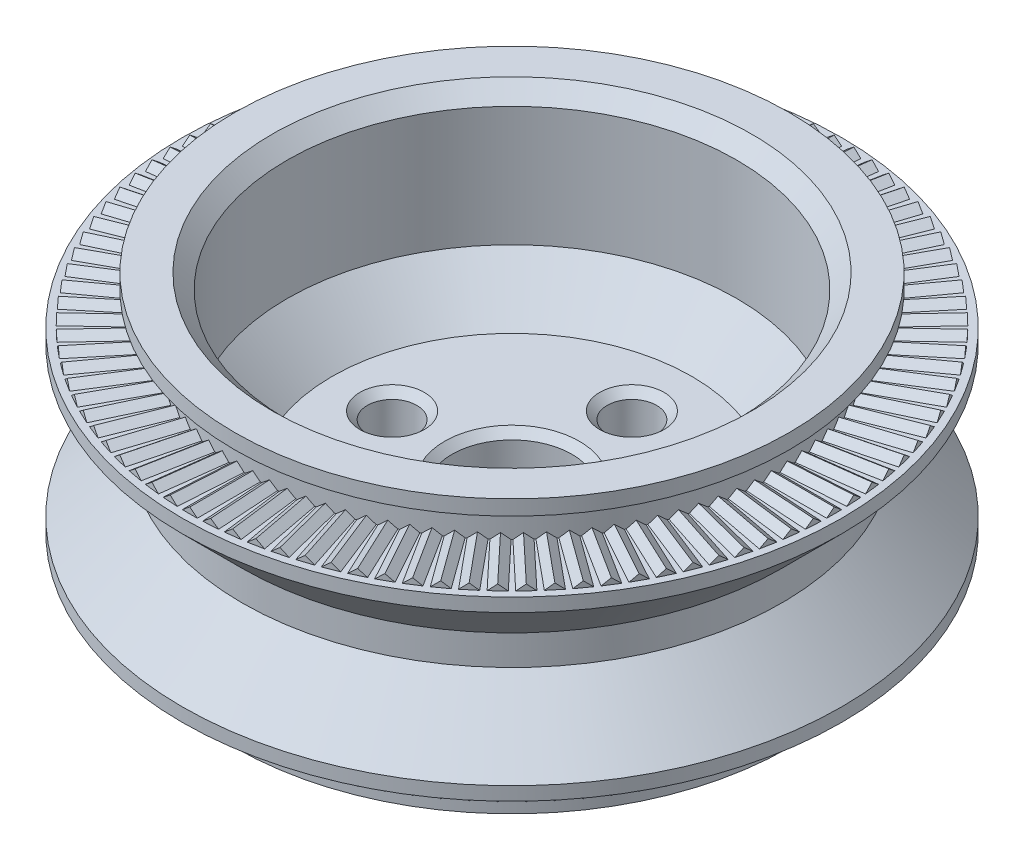
from build123d import *

# Parameters (mm, degrees)
SKETCH_1_R               = 22
EXTRUDE_1_DEPTH          = 9.1
SKETCH_2_W               = 4.7
SKETCH_2_H               = 2.2
SKETCH_2_W_2             = 3.5
SKETCH_2_H_2             = 1
SKETCH_3_R               = 15
CUT_EXTRUDE_1_DEPTH      = 3
SKETCH_4_R               = 4
CUT_EXTRUDE_2_DEPTH      = 20
SKETCH_5_R               = 1.65
CUT_EXTRUDE_3_DEPTH      = 20
PATTERN_CIRCULAR_1_COUNT = 4
CUT_EXTRUDE_START        = -6.2
SKETCH_3_2_R             = 15
CUT_EXTRUDE_4_DEPTH      = 12
SKETCH_6_W               = 4
SKETCH_6_H               = 10
CHAMFER_1_SIZE           = 4
CHAMFER_2_SIZE           = 3
CHAMFER_3_SIZE           = 1
CHAMFER_4_SIZE           = 0.5
EXTRUDE_START            = 16
EXTRUDE_4_DEPTH          = 5.5
PATTERN_CIRCULAR_2_COUNT = 100
MIRROR_START             = 16
MIRROR_2_COPY_1_DEPTH    = 5.5
MIRROR_2_COPY_2_DEPTH    = 5.5
MIRROR_2_COPY_3_DEPTH    = 5.5
MIRROR_2_COPY_4_DEPTH    = 5.5
MIRROR_2_COPY_5_DEPTH    = 5.5
MIRROR_2_COPY_6_DEPTH    = 5.5
MIRROR_2_COPY_7_DEPTH    = 5.5
MIRROR_2_COPY_8_DEPTH    = 5.5
MIRROR_2_COPY_9_DEPTH    = 5.5
MIRROR_2_COPY_10_DEPTH   = 5.5
MIRROR_2_COPY_11_DEPTH   = 5.5
MIRROR_2_COPY_12_DEPTH   = 5.5
MIRROR_2_COPY_13_DEPTH   = 5.5
MIRROR_2_COPY_14_DEPTH   = 5.5
MIRROR_2_COPY_15_DEPTH   = 5.5
MIRROR_2_COPY_16_DEPTH   = 5.5
MIRROR_2_COPY_17_DEPTH   = 5.5
MIRROR_2_COPY_18_DEPTH   = 5.5
MIRROR_2_COPY_19_DEPTH   = 5.5
MIRROR_2_COPY_20_DEPTH   = 5.5
MIRROR_2_COPY_21_DEPTH   = 5.5
MIRROR_2_COPY_22_DEPTH   = 5.5
MIRROR_2_COPY_23_DEPTH   = 5.5
MIRROR_2_COPY_24_DEPTH   = 5.5
MIRROR_2_COPY_25_DEPTH   = 5.5
MIRROR_2_COPY_26_DEPTH   = 5.5
MIRROR_2_COPY_27_DEPTH   = 5.5
MIRROR_2_COPY_28_DEPTH   = 5.5
MIRROR_2_COPY_29_DEPTH   = 5.5
MIRROR_2_COPY_30_DEPTH   = 5.5
MIRROR_2_COPY_31_DEPTH   = 5.5
MIRROR_2_COPY_32_DEPTH   = 5.5
MIRROR_2_COPY_33_DEPTH   = 5.5
MIRROR_2_COPY_34_DEPTH   = 5.5
MIRROR_2_COPY_35_DEPTH   = 5.5
MIRROR_2_COPY_36_DEPTH   = 5.5
MIRROR_2_COPY_37_DEPTH   = 5.5
MIRROR_2_COPY_38_DEPTH   = 5.5
MIRROR_2_COPY_39_DEPTH   = 5.5
MIRROR_2_COPY_40_DEPTH   = 5.5
MIRROR_2_COPY_41_DEPTH   = 5.5
MIRROR_2_COPY_42_DEPTH   = 5.5
MIRROR_2_COPY_43_DEPTH   = 5.5
MIRROR_2_COPY_44_DEPTH   = 5.5
MIRROR_2_COPY_45_DEPTH   = 5.5
MIRROR_2_COPY_46_DEPTH   = 5.5
MIRROR_2_COPY_47_DEPTH   = 5.5
MIRROR_2_COPY_48_DEPTH   = 5.5
MIRROR_2_COPY_49_DEPTH   = 5.5
MIRROR_2_COPY_50_DEPTH   = 5.5
MIRROR_2_COPY_51_DEPTH   = 5.5
MIRROR_2_COPY_52_DEPTH   = 5.5
MIRROR_2_COPY_53_DEPTH   = 5.5
MIRROR_2_COPY_54_DEPTH   = 5.5
MIRROR_2_COPY_55_DEPTH   = 5.5
MIRROR_2_COPY_56_DEPTH   = 5.5
MIRROR_2_COPY_57_DEPTH   = 5.5
MIRROR_2_COPY_58_DEPTH   = 5.5
MIRROR_2_COPY_59_DEPTH   = 5.5
MIRROR_2_COPY_60_DEPTH   = 5.5
MIRROR_2_COPY_61_DEPTH   = 5.5
MIRROR_2_COPY_62_DEPTH   = 5.5
MIRROR_2_COPY_63_DEPTH   = 5.5
MIRROR_2_COPY_64_DEPTH   = 5.5
MIRROR_2_COPY_65_DEPTH   = 5.5
MIRROR_2_COPY_66_DEPTH   = 5.5
MIRROR_2_COPY_67_DEPTH   = 5.5
MIRROR_2_COPY_68_DEPTH   = 5.5
MIRROR_2_COPY_69_DEPTH   = 5.5
MIRROR_2_COPY_70_DEPTH   = 5.5
MIRROR_2_COPY_71_DEPTH   = 5.5
MIRROR_2_COPY_72_DEPTH   = 5.5
MIRROR_2_COPY_73_DEPTH   = 5.5
MIRROR_2_COPY_74_DEPTH   = 5.5
MIRROR_2_COPY_75_DEPTH   = 5.5
MIRROR_2_COPY_76_DEPTH   = 5.5
MIRROR_2_COPY_77_DEPTH   = 5.5
MIRROR_2_COPY_78_DEPTH   = 5.5
MIRROR_2_COPY_79_DEPTH   = 5.5
MIRROR_2_COPY_80_DEPTH   = 5.5
MIRROR_2_COPY_81_DEPTH   = 5.5
MIRROR_2_COPY_82_DEPTH   = 5.5
MIRROR_2_COPY_83_DEPTH   = 5.5
MIRROR_2_COPY_84_DEPTH   = 5.5
MIRROR_2_COPY_85_DEPTH   = 5.5
MIRROR_2_COPY_86_DEPTH   = 5.5
MIRROR_2_COPY_87_DEPTH   = 5.5
MIRROR_2_COPY_88_DEPTH   = 5.5
MIRROR_2_COPY_89_DEPTH   = 5.5
MIRROR_2_COPY_90_DEPTH   = 5.5
MIRROR_2_COPY_91_DEPTH   = 5.5
MIRROR_2_COPY_92_DEPTH   = 5.5
MIRROR_2_COPY_93_DEPTH   = 5.5
MIRROR_2_COPY_94_DEPTH   = 5.5
MIRROR_2_COPY_95_DEPTH   = 5.5
MIRROR_2_COPY_96_DEPTH   = 5.5
MIRROR_2_COPY_97_DEPTH   = 5.5
MIRROR_2_COPY_98_DEPTH   = 5.5
MIRROR_2_COPY_99_DEPTH   = 5.5


with BuildPart() as part:
    # 草图1 → 凸台-拉伸1 (new, symmetric)
    with BuildSketch(Plane(origin=(0, 0, 0), x_dir=(1, 0, 0), z_dir=(0, 1, 0))):
        with Locations(Location((0, 0, 0), (0, 0, 270))):
            Circle(SKETCH_1_R)
    extrude(amount=EXTRUDE_1_DEPTH, both=True)

    # 草图2 → 切除-旋转1 (revolve, cut)
    with BuildSketch(Plane.XY, mode=Mode.PRIVATE) as cut_revolve_1_sk:
        with Locations((19.65, -7)):
            Rectangle(SKETCH_2_W, SKETCH_2_H)
        with Locations((20.25, -8.6)):
            Rectangle(SKETCH_2_W_2, SKETCH_2_H_2)
    cut_revolve_1 = revolve(cut_revolve_1_sk.sketch.rotate(Axis((0, 9.1, 0), (0, -1, 0)), 90), axis=Axis((0, 9.1, 0), (0, -1, 0)), mode=Mode.SUBTRACT)

    # 镜向1: 切除-旋转1 across plane
    add(cut_revolve_1.mirror(Plane.ZX), mode=Mode.SUBTRACT)

    # 草图3 → 切除-拉伸1 (cut)
    with BuildSketch(Plane.XZ.offset(9.1)):
        with Locations(Location((0, 0, 0), (0, 0, 270))):
            Circle(SKETCH_3_R)
    extrude(amount=-CUT_EXTRUDE_1_DEPTH, mode=Mode.SUBTRACT)

    # 草图4 → 切除-拉伸2 (cut)
    with BuildSketch(Plane.XZ.offset(6.1)):
        with Locations(Location((0, 0, 0), (0, 0, 270))):
            Circle(SKETCH_4_R)
    extrude(amount=-CUT_EXTRUDE_2_DEPTH, mode=Mode.SUBTRACT)

    # 草图5 → 切除-拉伸3 (cut)
    with BuildSketch(Plane.XZ.offset(6.1)):
        with Locations(Location((-8, 0, 0), (0, 0, 270))):
            Circle(SKETCH_5_R)
    cut_extrude_3 = extrude(amount=-CUT_EXTRUDE_3_DEPTH, mode=Mode.SUBTRACT)

    # 阵列(圆周)1: 切除-拉伸3 ×4 about axis
    pattern_circular_1_axis = Axis((0, 0, 0), (0, 1, 0))
    for i in range(1, PATTERN_CIRCULAR_1_COUNT):
        add(cut_extrude_3.rotate(pattern_circular_1_axis, i * 360 / PATTERN_CIRCULAR_1_COUNT), mode=Mode.SUBTRACT)

    # 草图3<2> → 切除-拉伸4 (cut)
    with BuildSketch(Plane.XZ.offset(9.1).offset(CUT_EXTRUDE_START)):
        with Locations(Location((0, 0, 0), (0, 0, 270))):
            Circle(SKETCH_3_2_R)
    extrude(amount=-CUT_EXTRUDE_4_DEPTH, mode=Mode.SUBTRACT)

    # 草图6 → 切除-旋转2 (revolve, cut)
    with BuildSketch(Plane.XY, mode=Mode.PRIVATE) as cut_revolve_2_sk:
        with Locations((20, 0)):
            Rectangle(SKETCH_6_W, SKETCH_6_H)
    revolve(cut_revolve_2_sk.sketch.rotate(Axis((0, 9.1, 0), (0, -1, 0)), 90), axis=Axis((0, 9.1, 0), (0, -1, 0)), mode=Mode.SUBTRACT)

    # 倒角1
    chamfer_1_edges = [part.edges().sort_by_distance(p)[0] for p in [
        (0, -5, -18),
        (0, 5, -18),
    ]]
    chamfer(chamfer_1_edges, length=CHAMFER_1_SIZE - 0.0001)  # a hair under: the kernel refuses the full size

    # 倒角2
    chamfer_2_edges = [part.edges().sort_by_distance(p)[0] for p in [
        (0, -6.1, 15),
        (0, -2.9, 15),
    ]]
    chamfer(chamfer_2_edges, length=CHAMFER_2_SIZE - 0.0001)  # a hair under: the kernel refuses the full size

    # 倒角3
    chamfer_3_edges = [part.edges().sort_by_distance(p)[0] for p in [
        (0, 9.1, 15),
    ]]
    chamfer(chamfer_3_edges, length=CHAMFER_3_SIZE)

    # 倒角4
    chamfer_4_edges = [part.edges().sort_by_distance(p)[0] for p in [
        (0, -6.1, 4),
        (-8, -6.1, 1.65),
        (-1.65, -6.1, -8),
        (8, -6.1, -1.65),
        (1.65, -6.1, 8),
        (0, -2.9, 4),
        (-8, -2.9, 1.65),
        (1.65, -2.9, 8),
        (8, -2.9, -1.65),
        (-1.65, -2.9, -8),
    ]]
    chamfer(chamfer_4_edges, length=CHAMFER_4_SIZE)

    # 草图7 → 凸台-拉伸4 (add)
    with BuildSketch(Plane.XY.offset(EXTRUDE_START)):
        Polygon((-0.5, 5.9), (0, 6.3), (0.5, 5.9), align=None)
    extrude_4 = extrude(amount=EXTRUDE_4_DEPTH)

    # 阵列(圆周)2: 凸台-拉伸4 ×100 about axis
    pattern_circular_2_axis = Axis((0, 0, 0), (0, 1, 0))
    for i in range(1, PATTERN_CIRCULAR_2_COUNT):
        add(extrude_4.rotate(pattern_circular_2_axis, i * 360 / PATTERN_CIRCULAR_2_COUNT))

    # 镜向2: 凸台-拉伸4 across plane
    add(extrude_4.mirror(Plane.ZX))

    # 镜向2 copy 1 sketch → 镜向2 copy 1 (add)
    with BuildSketch(Plane(origin=(0, 0, 0), x_dir=(0.9980267284282716, 0, -0.06279051952931337), z_dir=(0.06279051952931337, 0, 0.9980267284282716)).offset(MIRROR_START)):
        Polygon((-0.5, -5.9), (0, -6.3), (0.5, -5.9), align=None)
    extrude(amount=MIRROR_2_COPY_1_DEPTH)

    # 镜向2 copy 2 sketch → 镜向2 copy 2 (add)
    with BuildSketch(Plane(origin=(0, 0, 0), x_dir=(0.9921147013144779, 0, -0.12533323356430426), z_dir=(0.12533323356430426, 0, 0.9921147013144779)).offset(MIRROR_START)):
        Polygon((-0.5, -5.9), (0, -6.3), (0.5, -5.9), align=None)
    extrude(amount=MIRROR_2_COPY_2_DEPTH)

    # 镜向2 copy 3 sketch → 镜向2 copy 3 (add)
    with BuildSketch(Plane(origin=(0, 0, 0), x_dir=(0.9822872507286887, 0, -0.18738131458572463), z_dir=(0.18738131458572463, 0, 0.9822872507286887)).offset(MIRROR_START)):
        Polygon((-0.5, -5.9), (0, -6.3), (0.5, -5.9), align=None)
    extrude(amount=MIRROR_2_COPY_3_DEPTH)

    # 镜向2 copy 4 sketch → 镜向2 copy 4 (add)
    with BuildSketch(Plane(origin=(0, 0, 0), x_dir=(0.9685831611286311, 0, -0.2486898871648548), z_dir=(0.2486898871648548, 0, 0.9685831611286311)).offset(MIRROR_START)):
        Polygon((-0.5, -5.9), (0, -6.3), (0.5, -5.9), align=None)
    extrude(amount=MIRROR_2_COPY_4_DEPTH)

    # 镜向2 copy 5 sketch → 镜向2 copy 5 (add)
    with BuildSketch(Plane(origin=(0, 0, 0), x_dir=(0.9510565162951535, 0, -0.3090169943749474), z_dir=(0.3090169943749474, 0, 0.9510565162951535)).offset(MIRROR_START)):
        Polygon((-0.5, -5.9), (0, -6.3), (0.5, -5.9), align=None)
    extrude(amount=MIRROR_2_COPY_5_DEPTH)

    # 镜向2 copy 6 sketch → 镜向2 copy 6 (add)
    with BuildSketch(Plane(origin=(0, 0, 0), x_dir=(0.9297764858882513, 0, -0.368124552684678), z_dir=(0.368124552684678, 0, 0.9297764858882513)).offset(MIRROR_START)):
        Polygon((-0.5, -5.9), (0, -6.3), (0.5, -5.9), align=None)
    extrude(amount=MIRROR_2_COPY_6_DEPTH)

    # 镜向2 copy 7 sketch → 镜向2 copy 7 (add)
    with BuildSketch(Plane(origin=(0, 0, 0), x_dir=(0.9048270524660196, 0, -0.42577929156507266), z_dir=(0.42577929156507266, 0, 0.9048270524660196)).offset(MIRROR_START)):
        Polygon((-0.5, -5.9), (0, -6.3), (0.5, -5.9), align=None)
    extrude(amount=MIRROR_2_COPY_7_DEPTH)

    # 镜向2 copy 8 sketch → 镜向2 copy 8 (add)
    with BuildSketch(Plane(origin=(0, 0, 0), x_dir=(0.8763066800438636, 0, -0.4817536741017153), z_dir=(0.4817536741017153, 0, 0.8763066800438636)).offset(MIRROR_START)):
        Polygon((-0.5, -5.9), (0, -6.3), (0.5, -5.9), align=None)
    extrude(amount=MIRROR_2_COPY_8_DEPTH)

    # 镜向2 copy 9 sketch → 镜向2 copy 9 (add)
    with BuildSketch(Plane(origin=(0, 0, 0), x_dir=(0.8443279255020151, 0, -0.5358267949789967), z_dir=(0.5358267949789967, 0, 0.8443279255020151)).offset(MIRROR_START)):
        Polygon((-0.5, -5.9), (0, -6.3), (0.5, -5.9), align=None)
    extrude(amount=MIRROR_2_COPY_9_DEPTH)

    # 镜向2 copy 10 sketch → 镜向2 copy 10 (add)
    with BuildSketch(Plane(origin=(0, 0, 0), x_dir=(0.8090169943749475, 0, -0.5877852522924731), z_dir=(0.5877852522924731, 0, 0.8090169943749475)).offset(MIRROR_START)):
        Polygon((-0.5, -5.9), (0, -6.3), (0.5, -5.9), align=None)
    extrude(amount=MIRROR_2_COPY_10_DEPTH)

    # 镜向2 copy 11 sketch → 镜向2 copy 11 (add)
    with BuildSketch(Plane(origin=(0, 0, 0), x_dir=(0.7705132427757891, 0, -0.6374239897486897), z_dir=(0.6374239897486897, 0, 0.7705132427757891)).offset(MIRROR_START)):
        Polygon((-0.5, -5.9), (0, -6.3), (0.5, -5.9), align=None)
    extrude(amount=MIRROR_2_COPY_11_DEPTH)

    # 镜向2 copy 12 sketch → 镜向2 copy 12 (add)
    with BuildSketch(Plane(origin=(0, 0, 0), x_dir=(0.7289686274214116, 0, -0.6845471059286887), z_dir=(0.6845471059286887, 0, 0.7289686274214116)).offset(MIRROR_START)):
        Polygon((-0.5, -5.9), (0, -6.3), (0.5, -5.9), align=None)
    extrude(amount=MIRROR_2_COPY_12_DEPTH)

    # 镜向2 copy 13 sketch → 镜向2 copy 13 (add)
    with BuildSketch(Plane(origin=(0, 0, 0), x_dir=(0.6845471059286886, 0, -0.7289686274214116), z_dir=(0.7289686274214116, 0, 0.6845471059286886)).offset(MIRROR_START)):
        Polygon((-0.5, -5.9), (0, -6.3), (0.5, -5.9), align=None)
    extrude(amount=MIRROR_2_COPY_13_DEPTH)

    # 镜向2 copy 14 sketch → 镜向2 copy 14 (add)
    with BuildSketch(Plane(origin=(0, 0, 0), x_dir=(0.6374239897486897, 0, -0.7705132427757893), z_dir=(0.7705132427757893, 0, 0.6374239897486897)).offset(MIRROR_START)):
        Polygon((-0.5, -5.9), (0, -6.3), (0.5, -5.9), align=None)
    extrude(amount=MIRROR_2_COPY_14_DEPTH)

    # 镜向2 copy 15 sketch → 镜向2 copy 15 (add)
    with BuildSketch(Plane(origin=(0, 0, 0), x_dir=(0.5877852522924731, 0, -0.8090169943749475), z_dir=(0.8090169943749475, 0, 0.5877852522924731)).offset(MIRROR_START)):
        Polygon((-0.5, -5.9), (0, -6.3), (0.5, -5.9), align=None)
    extrude(amount=MIRROR_2_COPY_15_DEPTH)

    # 镜向2 copy 16 sketch → 镜向2 copy 16 (add)
    with BuildSketch(Plane(origin=(0, 0, 0), x_dir=(0.5358267949789965, 0, -0.8443279255020151), z_dir=(0.8443279255020151, 0, 0.5358267949789965)).offset(MIRROR_START)):
        Polygon((-0.5, -5.9), (0, -6.3), (0.5, -5.9), align=None)
    extrude(amount=MIRROR_2_COPY_16_DEPTH)

    # 镜向2 copy 17 sketch → 镜向2 copy 17 (add)
    with BuildSketch(Plane(origin=(0, 0, 0), x_dir=(0.48175367410171516, 0, -0.8763066800438637), z_dir=(0.8763066800438637, 0, 0.48175367410171516)).offset(MIRROR_START)):
        Polygon((-0.5, -5.9), (0, -6.3), (0.5, -5.9), align=None)
    extrude(amount=MIRROR_2_COPY_17_DEPTH)

    # 镜向2 copy 18 sketch → 镜向2 copy 18 (add)
    with BuildSketch(Plane(origin=(0, 0, 0), x_dir=(0.42577929156507266, 0, -0.9048270524660196), z_dir=(0.9048270524660196, 0, 0.42577929156507266)).offset(MIRROR_START)):
        Polygon((-0.5, -5.9), (0, -6.3), (0.5, -5.9), align=None)
    extrude(amount=MIRROR_2_COPY_18_DEPTH)

    # 镜向2 copy 19 sketch → 镜向2 copy 19 (add)
    with BuildSketch(Plane(origin=(0, 0, 0), x_dir=(0.36812455268467786, 0, -0.9297764858882515), z_dir=(0.9297764858882515, 0, 0.36812455268467786)).offset(MIRROR_START)):
        Polygon((-0.5, -5.9), (0, -6.3), (0.5, -5.9), align=None)
    extrude(amount=MIRROR_2_COPY_19_DEPTH)

    # 镜向2 copy 20 sketch → 镜向2 copy 20 (add)
    with BuildSketch(Plane(origin=(0, 0, 0), x_dir=(0.30901699437494745, 0, -0.9510565162951535), z_dir=(0.9510565162951535, 0, 0.30901699437494745)).offset(MIRROR_START)):
        Polygon((-0.5, -5.9), (0, -6.3), (0.5, -5.9), align=None)
    extrude(amount=MIRROR_2_COPY_20_DEPTH)

    # 镜向2 copy 21 sketch → 镜向2 copy 21 (add)
    with BuildSketch(Plane(origin=(0, 0, 0), x_dir=(0.24868988716485474, 0, -0.9685831611286311), z_dir=(0.9685831611286311, 0, 0.24868988716485474)).offset(MIRROR_START)):
        Polygon((-0.5, -5.9), (0, -6.3), (0.5, -5.9), align=None)
    extrude(amount=MIRROR_2_COPY_21_DEPTH)

    # 镜向2 copy 22 sketch → 镜向2 copy 22 (add)
    with BuildSketch(Plane(origin=(0, 0, 0), x_dir=(0.18738131458572452, 0, -0.9822872507286887), z_dir=(0.9822872507286887, 0, 0.18738131458572452)).offset(MIRROR_START)):
        Polygon((-0.5, -5.9), (0, -6.3), (0.5, -5.9), align=None)
    extrude(amount=MIRROR_2_COPY_22_DEPTH)

    # 镜向2 copy 23 sketch → 镜向2 copy 23 (add)
    with BuildSketch(Plane(origin=(0, 0, 0), x_dir=(0.12533323356430426, 0, -0.9921147013144779), z_dir=(0.9921147013144779, 0, 0.12533323356430426)).offset(MIRROR_START)):
        Polygon((-0.5, -5.9), (0, -6.3), (0.5, -5.9), align=None)
    extrude(amount=MIRROR_2_COPY_23_DEPTH)

    # 镜向2 copy 24 sketch → 镜向2 copy 24 (add)
    with BuildSketch(Plane(origin=(0, 0, 0), x_dir=(0.0627905195293133, 0, -0.9980267284282716), z_dir=(0.9980267284282716, 0, 0.0627905195293133)).offset(MIRROR_START)):
        Polygon((-0.5, -5.9), (0, -6.3), (0.5, -5.9), align=None)
    extrude(amount=MIRROR_2_COPY_24_DEPTH)

    # 镜向2 copy 25 sketch → 镜向2 copy 25 (add)
    with BuildSketch(Plane(origin=(0, 0, 0), x_dir=(0, 0, -1), z_dir=(1, 0, 0)).offset(MIRROR_START)):
        Polygon((-0.5, -5.9), (0, -6.3), (0.5, -5.9), align=None)
    extrude(amount=MIRROR_2_COPY_25_DEPTH)

    # 镜向2 copy 26 sketch → 镜向2 copy 26 (add)
    with BuildSketch(Plane(origin=(0, 0, 0), x_dir=(-0.0627905195293134, 0, -0.9980267284282716), z_dir=(0.9980267284282716, 0, -0.0627905195293134)).offset(MIRROR_START)):
        Polygon((-0.5, -5.9), (0, -6.3), (0.5, -5.9), align=None)
    extrude(amount=MIRROR_2_COPY_26_DEPTH)

    # 镜向2 copy 27 sketch → 镜向2 copy 27 (add)
    with BuildSketch(Plane(origin=(0, 0, 0), x_dir=(-0.12533323356430437, 0, -0.9921147013144778), z_dir=(0.9921147013144778, 0, -0.12533323356430437)).offset(MIRROR_START)):
        Polygon((-0.5, -5.9), (0, -6.3), (0.5, -5.9), align=None)
    extrude(amount=MIRROR_2_COPY_27_DEPTH)

    # 镜向2 copy 28 sketch → 镜向2 copy 28 (add)
    with BuildSketch(Plane(origin=(0, 0, 0), x_dir=(-0.1873813145857246, 0, -0.9822872507286887), z_dir=(0.9822872507286887, 0, -0.1873813145857246)).offset(MIRROR_START)):
        Polygon((-0.5, -5.9), (0, -6.3), (0.5, -5.9), align=None)
    extrude(amount=MIRROR_2_COPY_28_DEPTH)

    # 镜向2 copy 29 sketch → 镜向2 copy 29 (add)
    with BuildSketch(Plane(origin=(0, 0, 0), x_dir=(-0.24868988716485485, 0, -0.9685831611286311), z_dir=(0.9685831611286311, 0, -0.24868988716485485)).offset(MIRROR_START)):
        Polygon((-0.5, -5.9), (0, -6.3), (0.5, -5.9), align=None)
    extrude(amount=MIRROR_2_COPY_29_DEPTH)

    # 镜向2 copy 30 sketch → 镜向2 copy 30 (add)
    with BuildSketch(Plane(origin=(0, 0, 0), x_dir=(-0.30901699437494734, 0, -0.9510565162951536), z_dir=(0.9510565162951536, 0, -0.30901699437494734)).offset(MIRROR_START)):
        Polygon((-0.5, -5.9), (0, -6.3), (0.5, -5.9), align=None)
    extrude(amount=MIRROR_2_COPY_30_DEPTH)

    # 镜向2 copy 31 sketch → 镜向2 copy 31 (add)
    with BuildSketch(Plane(origin=(0, 0, 0), x_dir=(-0.368124552684678, 0, -0.9297764858882513), z_dir=(0.9297764858882513, 0, -0.368124552684678)).offset(MIRROR_START)):
        Polygon((-0.5, -5.9), (0, -6.3), (0.5, -5.9), align=None)
    extrude(amount=MIRROR_2_COPY_31_DEPTH)

    # 镜向2 copy 32 sketch → 镜向2 copy 32 (add)
    with BuildSketch(Plane(origin=(0, 0, 0), x_dir=(-0.4257792915650727, 0, -0.9048270524660195), z_dir=(0.9048270524660195, 0, -0.4257792915650727)).offset(MIRROR_START)):
        Polygon((-0.5, -5.9), (0, -6.3), (0.5, -5.9), align=None)
    extrude(amount=MIRROR_2_COPY_32_DEPTH)

    # 镜向2 copy 33 sketch → 镜向2 copy 33 (add)
    with BuildSketch(Plane(origin=(0, 0, 0), x_dir=(-0.48175367410171505, 0, -0.8763066800438637), z_dir=(0.8763066800438637, 0, -0.48175367410171505)).offset(MIRROR_START)):
        Polygon((-0.5, -5.9), (0, -6.3), (0.5, -5.9), align=None)
    extrude(amount=MIRROR_2_COPY_33_DEPTH)

    # 镜向2 copy 34 sketch → 镜向2 copy 34 (add)
    with BuildSketch(Plane(origin=(0, 0, 0), x_dir=(-0.5358267949789969, 0, -0.844327925502015), z_dir=(0.844327925502015, 0, -0.5358267949789969)).offset(MIRROR_START)):
        Polygon((-0.5, -5.9), (0, -6.3), (0.5, -5.9), align=None)
    extrude(amount=MIRROR_2_COPY_34_DEPTH)

    # 镜向2 copy 35 sketch → 镜向2 copy 35 (add)
    with BuildSketch(Plane(origin=(0, 0, 0), x_dir=(-0.587785252292473, 0, -0.8090169943749475), z_dir=(0.8090169943749475, 0, -0.587785252292473)).offset(MIRROR_START)):
        Polygon((-0.5, -5.9), (0, -6.3), (0.5, -5.9), align=None)
    extrude(amount=MIRROR_2_COPY_35_DEPTH)

    # 镜向2 copy 36 sketch → 镜向2 copy 36 (add)
    with BuildSketch(Plane(origin=(0, 0, 0), x_dir=(-0.6374239897486897, 0, -0.7705132427757893), z_dir=(0.7705132427757893, 0, -0.6374239897486897)).offset(MIRROR_START)):
        Polygon((-0.5, -5.9), (0, -6.3), (0.5, -5.9), align=None)
    extrude(amount=MIRROR_2_COPY_36_DEPTH)

    # 镜向2 copy 37 sketch → 镜向2 copy 37 (add)
    with BuildSketch(Plane(origin=(0, 0, 0), x_dir=(-0.6845471059286887, 0, -0.7289686274214114), z_dir=(0.7289686274214114, 0, -0.6845471059286887)).offset(MIRROR_START)):
        Polygon((-0.5, -5.9), (0, -6.3), (0.5, -5.9), align=None)
    extrude(amount=MIRROR_2_COPY_37_DEPTH)

    # 镜向2 copy 38 sketch → 镜向2 copy 38 (add)
    with BuildSketch(Plane(origin=(0, 0, 0), x_dir=(-0.7289686274214117, 0, -0.6845471059286885), z_dir=(0.6845471059286885, 0, -0.7289686274214117)).offset(MIRROR_START)):
        Polygon((-0.5, -5.9), (0, -6.3), (0.5, -5.9), align=None)
    extrude(amount=MIRROR_2_COPY_38_DEPTH)

    # 镜向2 copy 39 sketch → 镜向2 copy 39 (add)
    with BuildSketch(Plane(origin=(0, 0, 0), x_dir=(-0.7705132427757894, 0, -0.6374239897486895), z_dir=(0.6374239897486895, 0, -0.7705132427757894)).offset(MIRROR_START)):
        Polygon((-0.5, -5.9), (0, -6.3), (0.5, -5.9), align=None)
    extrude(amount=MIRROR_2_COPY_39_DEPTH)

    # 镜向2 copy 40 sketch → 镜向2 copy 40 (add)
    with BuildSketch(Plane(origin=(0, 0, 0), x_dir=(-0.8090169943749473, 0, -0.5877852522924732), z_dir=(0.5877852522924732, 0, -0.8090169943749473)).offset(MIRROR_START)):
        Polygon((-0.5, -5.9), (0, -6.3), (0.5, -5.9), align=None)
    extrude(amount=MIRROR_2_COPY_40_DEPTH)

    # 镜向2 copy 41 sketch → 镜向2 copy 41 (add)
    with BuildSketch(Plane(origin=(0, 0, 0), x_dir=(-0.8443279255020151, 0, -0.5358267949789967), z_dir=(0.5358267949789967, 0, -0.8443279255020151)).offset(MIRROR_START)):
        Polygon((-0.5, -5.9), (0, -6.3), (0.5, -5.9), align=None)
    extrude(amount=MIRROR_2_COPY_41_DEPTH)

    # 镜向2 copy 42 sketch → 镜向2 copy 42 (add)
    with BuildSketch(Plane(origin=(0, 0, 0), x_dir=(-0.8763066800438636, 0, -0.4817536741017152), z_dir=(0.4817536741017152, 0, -0.8763066800438636)).offset(MIRROR_START)):
        Polygon((-0.5, -5.9), (0, -6.3), (0.5, -5.9), align=None)
    extrude(amount=MIRROR_2_COPY_42_DEPTH)

    # 镜向2 copy 43 sketch → 镜向2 copy 43 (add)
    with BuildSketch(Plane(origin=(0, 0, 0), x_dir=(-0.9048270524660196, 0, -0.4257792915650725), z_dir=(0.4257792915650725, 0, -0.9048270524660196)).offset(MIRROR_START)):
        Polygon((-0.5, -5.9), (0, -6.3), (0.5, -5.9), align=None)
    extrude(amount=MIRROR_2_COPY_43_DEPTH)

    # 镜向2 copy 44 sketch → 镜向2 copy 44 (add)
    with BuildSketch(Plane(origin=(0, 0, 0), x_dir=(-0.9297764858882515, 0, -0.36812455268467775), z_dir=(0.36812455268467775, 0, -0.9297764858882515)).offset(MIRROR_START)):
        Polygon((-0.5, -5.9), (0, -6.3), (0.5, -5.9), align=None)
    extrude(amount=MIRROR_2_COPY_44_DEPTH)

    # 镜向2 copy 45 sketch → 镜向2 copy 45 (add)
    with BuildSketch(Plane(origin=(0, 0, 0), x_dir=(-0.9510565162951535, 0, -0.3090169943749475), z_dir=(0.3090169943749475, 0, -0.9510565162951535)).offset(MIRROR_START)):
        Polygon((-0.5, -5.9), (0, -6.3), (0.5, -5.9), align=None)
    extrude(amount=MIRROR_2_COPY_45_DEPTH)

    # 镜向2 copy 46 sketch → 镜向2 copy 46 (add)
    with BuildSketch(Plane(origin=(0, 0, 0), x_dir=(-0.9685831611286311, 0, -0.24868988716485482), z_dir=(0.24868988716485482, 0, -0.9685831611286311)).offset(MIRROR_START)):
        Polygon((-0.5, -5.9), (0, -6.3), (0.5, -5.9), align=None)
    extrude(amount=MIRROR_2_COPY_46_DEPTH)

    # 镜向2 copy 47 sketch → 镜向2 copy 47 (add)
    with BuildSketch(Plane(origin=(0, 0, 0), x_dir=(-0.9822872507286887, 0, -0.18738131458572457), z_dir=(0.18738131458572457, 0, -0.9822872507286887)).offset(MIRROR_START)):
        Polygon((-0.5, -5.9), (0, -6.3), (0.5, -5.9), align=None)
    extrude(amount=MIRROR_2_COPY_47_DEPTH)

    # 镜向2 copy 48 sketch → 镜向2 copy 48 (add)
    with BuildSketch(Plane(origin=(0, 0, 0), x_dir=(-0.9921147013144779, 0, -0.1253332335643041), z_dir=(0.1253332335643041, 0, -0.9921147013144779)).offset(MIRROR_START)):
        Polygon((-0.5, -5.9), (0, -6.3), (0.5, -5.9), align=None)
    extrude(amount=MIRROR_2_COPY_48_DEPTH)

    # 镜向2 copy 49 sketch → 镜向2 copy 49 (add)
    with BuildSketch(Plane(origin=(0, 0, 0), x_dir=(-0.9980267284282716, 0, -0.06279051952931314), z_dir=(0.06279051952931314, 0, -0.9980267284282716)).offset(MIRROR_START)):
        Polygon((-0.5, -5.9), (0, -6.3), (0.5, -5.9), align=None)
    extrude(amount=MIRROR_2_COPY_49_DEPTH)

    # 镜向2 copy 50 sketch → 镜向2 copy 50 (add)
    with BuildSketch(Plane(origin=(0, 0, 0), x_dir=(-1, 0, 0), z_dir=(0, 0, -1)).offset(MIRROR_START)):
        Polygon((-0.5, -5.9), (0, -6.3), (0.5, -5.9), align=None)
    extrude(amount=MIRROR_2_COPY_50_DEPTH)

    # 镜向2 copy 51 sketch → 镜向2 copy 51 (add)
    with BuildSketch(Plane(origin=(0, 0, 0), x_dir=(-0.9980267284282716, 0, 0.06279051952931335), z_dir=(-0.06279051952931335, 0, -0.9980267284282716)).offset(MIRROR_START)):
        Polygon((-0.5, -5.9), (0, -6.3), (0.5, -5.9), align=None)
    extrude(amount=MIRROR_2_COPY_51_DEPTH)

    # 镜向2 copy 52 sketch → 镜向2 copy 52 (add)
    with BuildSketch(Plane(origin=(0, 0, 0), x_dir=(-0.9921147013144779, 0, 0.12533323356430429), z_dir=(-0.12533323356430429, 0, -0.9921147013144779)).offset(MIRROR_START)):
        Polygon((-0.5, -5.9), (0, -6.3), (0.5, -5.9), align=None)
    extrude(amount=MIRROR_2_COPY_52_DEPTH)

    # 镜向2 copy 53 sketch → 镜向2 copy 53 (add)
    with BuildSketch(Plane(origin=(0, 0, 0), x_dir=(-0.9822872507286886, 0, 0.18738131458572477), z_dir=(-0.18738131458572477, 0, -0.9822872507286886)).offset(MIRROR_START)):
        Polygon((-0.5, -5.9), (0, -6.3), (0.5, -5.9), align=None)
    extrude(amount=MIRROR_2_COPY_53_DEPTH)

    # 镜向2 copy 54 sketch → 镜向2 copy 54 (add)
    with BuildSketch(Plane(origin=(0, 0, 0), x_dir=(-0.9685831611286311, 0, 0.24868988716485502), z_dir=(-0.24868988716485502, 0, -0.9685831611286311)).offset(MIRROR_START)):
        Polygon((-0.5, -5.9), (0, -6.3), (0.5, -5.9), align=None)
    extrude(amount=MIRROR_2_COPY_54_DEPTH)

    # 镜向2 copy 55 sketch → 镜向2 copy 55 (add)
    with BuildSketch(Plane(origin=(0, 0, 0), x_dir=(-0.9510565162951536, 0, 0.3090169943749473), z_dir=(-0.3090169943749473, 0, -0.9510565162951536)).offset(MIRROR_START)):
        Polygon((-0.5, -5.9), (0, -6.3), (0.5, -5.9), align=None)
    extrude(amount=MIRROR_2_COPY_55_DEPTH)

    # 镜向2 copy 56 sketch → 镜向2 copy 56 (add)
    with BuildSketch(Plane(origin=(0, 0, 0), x_dir=(-0.9297764858882515, 0, 0.3681245526846779), z_dir=(-0.3681245526846779, 0, -0.9297764858882515)).offset(MIRROR_START)):
        Polygon((-0.5, -5.9), (0, -6.3), (0.5, -5.9), align=None)
    extrude(amount=MIRROR_2_COPY_56_DEPTH)

    # 镜向2 copy 57 sketch → 镜向2 copy 57 (add)
    with BuildSketch(Plane(origin=(0, 0, 0), x_dir=(-0.9048270524660195, 0, 0.42577929156507266), z_dir=(-0.42577929156507266, 0, -0.9048270524660195)).offset(MIRROR_START)):
        Polygon((-0.5, -5.9), (0, -6.3), (0.5, -5.9), align=None)
    extrude(amount=MIRROR_2_COPY_57_DEPTH)

    # 镜向2 copy 58 sketch → 镜向2 copy 58 (add)
    with BuildSketch(Plane(origin=(0, 0, 0), x_dir=(-0.8763066800438635, 0, 0.4817536741017154), z_dir=(-0.4817536741017154, 0, -0.8763066800438635)).offset(MIRROR_START)):
        Polygon((-0.5, -5.9), (0, -6.3), (0.5, -5.9), align=None)
    extrude(amount=MIRROR_2_COPY_58_DEPTH)

    # 镜向2 copy 59 sketch → 镜向2 copy 59 (add)
    with BuildSketch(Plane(origin=(0, 0, 0), x_dir=(-0.844327925502015, 0, 0.5358267949789968), z_dir=(-0.5358267949789968, 0, -0.844327925502015)).offset(MIRROR_START)):
        Polygon((-0.5, -5.9), (0, -6.3), (0.5, -5.9), align=None)
    extrude(amount=MIRROR_2_COPY_59_DEPTH)

    # 镜向2 copy 60 sketch → 镜向2 copy 60 (add)
    with BuildSketch(Plane(origin=(0, 0, 0), x_dir=(-0.8090169943749476, 0, 0.587785252292473), z_dir=(-0.587785252292473, 0, -0.8090169943749476)).offset(MIRROR_START)):
        Polygon((-0.5, -5.9), (0, -6.3), (0.5, -5.9), align=None)
    extrude(amount=MIRROR_2_COPY_60_DEPTH)

    # 镜向2 copy 61 sketch → 镜向2 copy 61 (add)
    with BuildSketch(Plane(origin=(0, 0, 0), x_dir=(-0.7705132427757893, 0, 0.6374239897486896), z_dir=(-0.6374239897486896, 0, -0.7705132427757893)).offset(MIRROR_START)):
        Polygon((-0.5, -5.9), (0, -6.3), (0.5, -5.9), align=None)
    extrude(amount=MIRROR_2_COPY_61_DEPTH)

    # 镜向2 copy 62 sketch → 镜向2 copy 62 (add)
    with BuildSketch(Plane(origin=(0, 0, 0), x_dir=(-0.7289686274214116, 0, 0.6845471059286887), z_dir=(-0.6845471059286887, 0, -0.7289686274214116)).offset(MIRROR_START)):
        Polygon((-0.5, -5.9), (0, -6.3), (0.5, -5.9), align=None)
    extrude(amount=MIRROR_2_COPY_62_DEPTH)

    # 镜向2 copy 63 sketch → 镜向2 copy 63 (add)
    with BuildSketch(Plane(origin=(0, 0, 0), x_dir=(-0.6845471059286886, 0, 0.7289686274214116), z_dir=(-0.7289686274214116, 0, -0.6845471059286886)).offset(MIRROR_START)):
        Polygon((-0.5, -5.9), (0, -6.3), (0.5, -5.9), align=None)
    extrude(amount=MIRROR_2_COPY_63_DEPTH)

    # 镜向2 copy 64 sketch → 镜向2 copy 64 (add)
    with BuildSketch(Plane(origin=(0, 0, 0), x_dir=(-0.6374239897486895, 0, 0.7705132427757894), z_dir=(-0.7705132427757894, 0, -0.6374239897486895)).offset(MIRROR_START)):
        Polygon((-0.5, -5.9), (0, -6.3), (0.5, -5.9), align=None)
    extrude(amount=MIRROR_2_COPY_64_DEPTH)

    # 镜向2 copy 65 sketch → 镜向2 copy 65 (add)
    with BuildSketch(Plane(origin=(0, 0, 0), x_dir=(-0.5877852522924732, 0, 0.8090169943749473), z_dir=(-0.8090169943749473, 0, -0.5877852522924732)).offset(MIRROR_START)):
        Polygon((-0.5, -5.9), (0, -6.3), (0.5, -5.9), align=None)
    extrude(amount=MIRROR_2_COPY_65_DEPTH)

    # 镜向2 copy 66 sketch → 镜向2 copy 66 (add)
    with BuildSketch(Plane(origin=(0, 0, 0), x_dir=(-0.5358267949789971, 0, 0.8443279255020149), z_dir=(-0.8443279255020149, 0, -0.5358267949789971)).offset(MIRROR_START)):
        Polygon((-0.5, -5.9), (0, -6.3), (0.5, -5.9), align=None)
    extrude(amount=MIRROR_2_COPY_66_DEPTH)

    # 镜向2 copy 67 sketch → 镜向2 copy 67 (add)
    with BuildSketch(Plane(origin=(0, 0, 0), x_dir=(-0.48175367410171527, 0, 0.8763066800438636), z_dir=(-0.8763066800438636, 0, -0.48175367410171527)).offset(MIRROR_START)):
        Polygon((-0.5, -5.9), (0, -6.3), (0.5, -5.9), align=None)
    extrude(amount=MIRROR_2_COPY_67_DEPTH)

    # 镜向2 copy 68 sketch → 镜向2 copy 68 (add)
    with BuildSketch(Plane(origin=(0, 0, 0), x_dir=(-0.42577929156507216, 0, 0.9048270524660198), z_dir=(-0.9048270524660198, 0, -0.42577929156507216)).offset(MIRROR_START)):
        Polygon((-0.5, -5.9), (0, -6.3), (0.5, -5.9), align=None)
    extrude(amount=MIRROR_2_COPY_68_DEPTH)

    # 镜向2 copy 69 sketch → 镜向2 copy 69 (add)
    with BuildSketch(Plane(origin=(0, 0, 0), x_dir=(-0.3681245526846778, 0, 0.9297764858882515), z_dir=(-0.9297764858882515, 0, -0.3681245526846778)).offset(MIRROR_START)):
        Polygon((-0.5, -5.9), (0, -6.3), (0.5, -5.9), align=None)
    extrude(amount=MIRROR_2_COPY_69_DEPTH)

    # 镜向2 copy 70 sketch → 镜向2 copy 70 (add)
    with BuildSketch(Plane(origin=(0, 0, 0), x_dir=(-0.30901699437494756, 0, 0.9510565162951535), z_dir=(-0.9510565162951535, 0, -0.30901699437494756)).offset(MIRROR_START)):
        Polygon((-0.5, -5.9), (0, -6.3), (0.5, -5.9), align=None)
    extrude(amount=MIRROR_2_COPY_70_DEPTH)

    # 镜向2 copy 71 sketch → 镜向2 copy 71 (add)
    with BuildSketch(Plane(origin=(0, 0, 0), x_dir=(-0.2486898871648553, 0, 0.968583161128631), z_dir=(-0.968583161128631, 0, -0.2486898871648553)).offset(MIRROR_START)):
        Polygon((-0.5, -5.9), (0, -6.3), (0.5, -5.9), align=None)
    extrude(amount=MIRROR_2_COPY_71_DEPTH)

    # 镜向2 copy 72 sketch → 镜向2 copy 72 (add)
    with BuildSketch(Plane(origin=(0, 0, 0), x_dir=(-0.18738131458572463, 0, 0.9822872507286887), z_dir=(-0.9822872507286887, 0, -0.18738131458572463)).offset(MIRROR_START)):
        Polygon((-0.5, -5.9), (0, -6.3), (0.5, -5.9), align=None)
    extrude(amount=MIRROR_2_COPY_72_DEPTH)

    # 镜向2 copy 73 sketch → 镜向2 copy 73 (add)
    with BuildSketch(Plane(origin=(0, 0, 0), x_dir=(-0.12533323356430373, 0, 0.9921147013144779), z_dir=(-0.9921147013144779, 0, -0.12533323356430373)).offset(MIRROR_START)):
        Polygon((-0.5, -5.9), (0, -6.3), (0.5, -5.9), align=None)
    extrude(amount=MIRROR_2_COPY_73_DEPTH)

    # 镜向2 copy 74 sketch → 镜向2 copy 74 (add)
    with BuildSketch(Plane(origin=(0, 0, 0), x_dir=(-0.06279051952931321, 0, 0.9980267284282716), z_dir=(-0.9980267284282716, 0, -0.06279051952931321)).offset(MIRROR_START)):
        Polygon((-0.5, -5.9), (0, -6.3), (0.5, -5.9), align=None)
    extrude(amount=MIRROR_2_COPY_74_DEPTH)

    # 镜向2 copy 75 sketch → 镜向2 copy 75 (add)
    with BuildSketch(Plane.ZY.offset(MIRROR_START)):
        Polygon((-0.5, -5.9), (0, -6.3), (0.5, -5.9), align=None)
    extrude(amount=MIRROR_2_COPY_75_DEPTH)

    # 镜向2 copy 76 sketch → 镜向2 copy 76 (add)
    with BuildSketch(Plane(origin=(0, 0, 0), x_dir=(0.06279051952931372, 0, 0.9980267284282716), z_dir=(-0.9980267284282716, 0, 0.06279051952931372)).offset(MIRROR_START)):
        Polygon((-0.5, -5.9), (0, -6.3), (0.5, -5.9), align=None)
    extrude(amount=MIRROR_2_COPY_76_DEPTH)

    # 镜向2 copy 77 sketch → 镜向2 copy 77 (add)
    with BuildSketch(Plane(origin=(0, 0, 0), x_dir=(0.12533323356430423, 0, 0.9921147013144779), z_dir=(-0.9921147013144779, 0, 0.12533323356430423)).offset(MIRROR_START)):
        Polygon((-0.5, -5.9), (0, -6.3), (0.5, -5.9), align=None)
    extrude(amount=MIRROR_2_COPY_77_DEPTH)

    # 镜向2 copy 78 sketch → 镜向2 copy 78 (add)
    with BuildSketch(Plane(origin=(0, 0, 0), x_dir=(0.18738131458572513, 0, 0.9822872507286886), z_dir=(-0.9822872507286886, 0, 0.18738131458572513)).offset(MIRROR_START)):
        Polygon((-0.5, -5.9), (0, -6.3), (0.5, -5.9), align=None)
    extrude(amount=MIRROR_2_COPY_78_DEPTH)

    # 镜向2 copy 79 sketch → 镜向2 copy 79 (add)
    with BuildSketch(Plane(origin=(0, 0, 0), x_dir=(0.24868988716485493, 0, 0.9685831611286311), z_dir=(-0.9685831611286311, 0, 0.24868988716485493)).offset(MIRROR_START)):
        Polygon((-0.5, -5.9), (0, -6.3), (0.5, -5.9), align=None)
    extrude(amount=MIRROR_2_COPY_79_DEPTH)

    # 镜向2 copy 80 sketch → 镜向2 copy 80 (add)
    with BuildSketch(Plane(origin=(0, 0, 0), x_dir=(0.30901699437494723, 0, 0.9510565162951536), z_dir=(-0.9510565162951536, 0, 0.30901699437494723)).offset(MIRROR_START)):
        Polygon((-0.5, -5.9), (0, -6.3), (0.5, -5.9), align=None)
    extrude(amount=MIRROR_2_COPY_80_DEPTH)

    # 镜向2 copy 81 sketch → 镜向2 copy 81 (add)
    with BuildSketch(Plane(origin=(0, 0, 0), x_dir=(0.36812455268467825, 0, 0.9297764858882512), z_dir=(-0.9297764858882512, 0, 0.36812455268467825)).offset(MIRROR_START)):
        Polygon((-0.5, -5.9), (0, -6.3), (0.5, -5.9), align=None)
    extrude(amount=MIRROR_2_COPY_81_DEPTH)

    # 镜向2 copy 82 sketch → 镜向2 copy 82 (add)
    with BuildSketch(Plane(origin=(0, 0, 0), x_dir=(0.4257792915650726, 0, 0.9048270524660196), z_dir=(-0.9048270524660196, 0, 0.4257792915650726)).offset(MIRROR_START)):
        Polygon((-0.5, -5.9), (0, -6.3), (0.5, -5.9), align=None)
    extrude(amount=MIRROR_2_COPY_82_DEPTH)

    # 镜向2 copy 83 sketch → 镜向2 copy 83 (add)
    with BuildSketch(Plane(origin=(0, 0, 0), x_dir=(0.4817536741017157, 0, 0.8763066800438634), z_dir=(-0.8763066800438634, 0, 0.4817536741017157)).offset(MIRROR_START)):
        Polygon((-0.5, -5.9), (0, -6.3), (0.5, -5.9), align=None)
    extrude(amount=MIRROR_2_COPY_83_DEPTH)

    # 镜向2 copy 84 sketch → 镜向2 copy 84 (add)
    with BuildSketch(Plane(origin=(0, 0, 0), x_dir=(0.5358267949789968, 0, 0.844327925502015), z_dir=(-0.844327925502015, 0, 0.5358267949789968)).offset(MIRROR_START)):
        Polygon((-0.5, -5.9), (0, -6.3), (0.5, -5.9), align=None)
    extrude(amount=MIRROR_2_COPY_84_DEPTH)

    # 镜向2 copy 85 sketch → 镜向2 copy 85 (add)
    with BuildSketch(Plane(origin=(0, 0, 0), x_dir=(0.5877852522924729, 0, 0.8090169943749476), z_dir=(-0.8090169943749476, 0, 0.5877852522924729)).offset(MIRROR_START)):
        Polygon((-0.5, -5.9), (0, -6.3), (0.5, -5.9), align=None)
    extrude(amount=MIRROR_2_COPY_85_DEPTH)

    # 镜向2 copy 86 sketch → 镜向2 copy 86 (add)
    with BuildSketch(Plane(origin=(0, 0, 0), x_dir=(0.63742398974869, 0, 0.770513242775789), z_dir=(-0.770513242775789, 0, 0.63742398974869)).offset(MIRROR_START)):
        Polygon((-0.5, -5.9), (0, -6.3), (0.5, -5.9), align=None)
    extrude(amount=MIRROR_2_COPY_86_DEPTH)

    # 镜向2 copy 87 sketch → 镜向2 copy 87 (add)
    with BuildSketch(Plane(origin=(0, 0, 0), x_dir=(0.6845471059286886, 0, 0.7289686274214116), z_dir=(-0.7289686274214116, 0, 0.6845471059286886)).offset(MIRROR_START)):
        Polygon((-0.5, -5.9), (0, -6.3), (0.5, -5.9), align=None)
    extrude(amount=MIRROR_2_COPY_87_DEPTH)

    # 镜向2 copy 88 sketch → 镜向2 copy 88 (add)
    with BuildSketch(Plane(origin=(0, 0, 0), x_dir=(0.7289686274214119, 0, 0.6845471059286883), z_dir=(-0.6845471059286883, 0, 0.7289686274214119)).offset(MIRROR_START)):
        Polygon((-0.5, -5.9), (0, -6.3), (0.5, -5.9), align=None)
    extrude(amount=MIRROR_2_COPY_88_DEPTH)

    # 镜向2 copy 89 sketch → 镜向2 copy 89 (add)
    with BuildSketch(Plane(origin=(0, 0, 0), x_dir=(0.7705132427757894, 0, 0.6374239897486896), z_dir=(-0.6374239897486896, 0, 0.7705132427757894)).offset(MIRROR_START)):
        Polygon((-0.5, -5.9), (0, -6.3), (0.5, -5.9), align=None)
    extrude(amount=MIRROR_2_COPY_89_DEPTH)

    # 镜向2 copy 90 sketch → 镜向2 copy 90 (add)
    with BuildSketch(Plane(origin=(0, 0, 0), x_dir=(0.8090169943749473, 0, 0.5877852522924734), z_dir=(-0.5877852522924734, 0, 0.8090169943749473)).offset(MIRROR_START)):
        Polygon((-0.5, -5.9), (0, -6.3), (0.5, -5.9), align=None)
    extrude(amount=MIRROR_2_COPY_90_DEPTH)

    # 镜向2 copy 91 sketch → 镜向2 copy 91 (add)
    with BuildSketch(Plane(origin=(0, 0, 0), x_dir=(0.8443279255020153, 0, 0.5358267949789963), z_dir=(-0.5358267949789963, 0, 0.8443279255020153)).offset(MIRROR_START)):
        Polygon((-0.5, -5.9), (0, -6.3), (0.5, -5.9), align=None)
    extrude(amount=MIRROR_2_COPY_91_DEPTH)

    # 镜向2 copy 92 sketch → 镜向2 copy 92 (add)
    with BuildSketch(Plane(origin=(0, 0, 0), x_dir=(0.8763066800438636, 0, 0.4817536741017153), z_dir=(-0.4817536741017153, 0, 0.8763066800438636)).offset(MIRROR_START)):
        Polygon((-0.5, -5.9), (0, -6.3), (0.5, -5.9), align=None)
    extrude(amount=MIRROR_2_COPY_92_DEPTH)

    # 镜向2 copy 93 sketch → 镜向2 copy 93 (add)
    with BuildSketch(Plane(origin=(0, 0, 0), x_dir=(0.9048270524660197, 0, 0.4257792915650722), z_dir=(-0.4257792915650722, 0, 0.9048270524660197)).offset(MIRROR_START)):
        Polygon((-0.5, -5.9), (0, -6.3), (0.5, -5.9), align=None)
    extrude(amount=MIRROR_2_COPY_93_DEPTH)

    # 镜向2 copy 94 sketch → 镜向2 copy 94 (add)
    with BuildSketch(Plane(origin=(0, 0, 0), x_dir=(0.9297764858882515, 0, 0.36812455268467786), z_dir=(-0.36812455268467786, 0, 0.9297764858882515)).offset(MIRROR_START)):
        Polygon((-0.5, -5.9), (0, -6.3), (0.5, -5.9), align=None)
    extrude(amount=MIRROR_2_COPY_94_DEPTH)

    # 镜向2 copy 95 sketch → 镜向2 copy 95 (add)
    with BuildSketch(Plane(origin=(0, 0, 0), x_dir=(0.9510565162951535, 0, 0.3090169943749476), z_dir=(-0.3090169943749476, 0, 0.9510565162951535)).offset(MIRROR_START)):
        Polygon((-0.5, -5.9), (0, -6.3), (0.5, -5.9), align=None)
    extrude(amount=MIRROR_2_COPY_95_DEPTH)

    # 镜向2 copy 96 sketch → 镜向2 copy 96 (add)
    with BuildSketch(Plane(origin=(0, 0, 0), x_dir=(0.9685831611286312, 0, 0.2486898871648545), z_dir=(-0.2486898871648545, 0, 0.9685831611286312)).offset(MIRROR_START)):
        Polygon((-0.5, -5.9), (0, -6.3), (0.5, -5.9), align=None)
    extrude(amount=MIRROR_2_COPY_96_DEPTH)

    # 镜向2 copy 97 sketch → 镜向2 copy 97 (add)
    with BuildSketch(Plane(origin=(0, 0, 0), x_dir=(0.9822872507286887, 0, 0.18738131458572468), z_dir=(-0.18738131458572468, 0, 0.9822872507286887)).offset(MIRROR_START)):
        Polygon((-0.5, -5.9), (0, -6.3), (0.5, -5.9), align=None)
    extrude(amount=MIRROR_2_COPY_97_DEPTH)

    # 镜向2 copy 98 sketch → 镜向2 copy 98 (add)
    with BuildSketch(Plane(origin=(0, 0, 0), x_dir=(0.9921147013144779, 0, 0.1253332335643038), z_dir=(-0.1253332335643038, 0, 0.9921147013144779)).offset(MIRROR_START)):
        Polygon((-0.5, -5.9), (0, -6.3), (0.5, -5.9), align=None)
    extrude(amount=MIRROR_2_COPY_98_DEPTH)

    # 镜向2 copy 99 sketch → 镜向2 copy 99 (add)
    with BuildSketch(Plane(origin=(0, 0, 0), x_dir=(0.9980267284282716, 0, 0.06279051952931326), z_dir=(-0.06279051952931326, 0, 0.9980267284282716)).offset(MIRROR_START)):
        Polygon((-0.5, -5.9), (0, -6.3), (0.5, -5.9), align=None)
    extrude(amount=MIRROR_2_COPY_99_DEPTH)


solid = part.part
